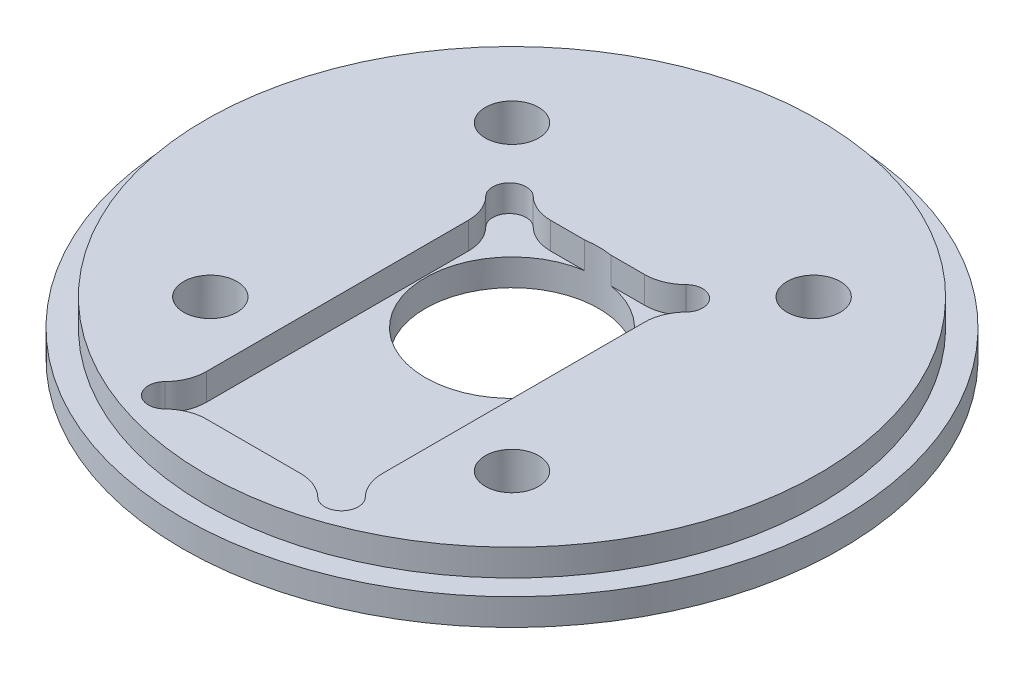
from build123d import *

# Parameters (mm, degrees)
SKETCH2_R                       = 39.243
BOSS_EXTRUDE1_DEPTH             = 6.35
CUT_EXTRUDE1_START              = -3.175
SKETCH4_R                       = 39.243
SKETCH4_R_2                     = 36.5125
CUT_EXTRUDE1_DEPTH              = 3.175
F_1_4_0_25_DIAMETER_HOLE1_D     = 6.35
F_13_16_0_8125_DIAMETER_HOLE1_D = 20.6375
CUT_EXTRUDE3_DEPTH              = 3.175
SKETCH9_R                       = 6.0325
CUT_EXTRUDE2_DEPTH              = 1.5875


with BuildPart() as part:
    # Sketch2 → Boss-Extrude1 (new body)
    with BuildSketch(Plane(origin=(0, 0, 0), x_dir=(1, 0, 0), z_dir=(0, 1, 0))):
        Circle(SKETCH2_R)
    extrude(amount=BOSS_EXTRUDE1_DEPTH)

    # Sketch4 → Cut-Extrude1 (cut)
    with BuildSketch(Plane(origin=(0, 6.35, 0), x_dir=(1, 0, 0), z_dir=(0, 1, 0)).offset(CUT_EXTRUDE1_START)):
        Circle(SKETCH4_R)
        Circle(SKETCH4_R_2, mode=Mode.SUBTRACT)
    extrude(amount=CUT_EXTRUDE1_DEPTH, mode=Mode.SUBTRACT)

    # 1/4 (0.25) Diameter Hole1 (through all)
    with Locations(Plane(origin=(0, 6.35, 0), x_dir=(1, 0, 0), z_dir=(0, 1, 0))):
        with Locations((-17.960512242, 17.960512242), (-17.960512242, -17.960512242), (17.960512242, 17.960512242), (17.960512242, -17.960512242)):
            Hole(F_1_4_0_25_DIAMETER_HOLE1_D / 2)

    # 13/16 (0.8125) Diameter Hole1 (through all)
    with Locations(Plane(origin=(0, 6.35, 0), x_dir=(1, 0, 0), z_dir=(0, 1, 0))):
        with Locations((0, 0)):
            Hole(F_13_16_0_8125_DIAMETER_HOLE1_D / 2)

    # Sketch11 → Cut-Extrude3 (cut)
    with BuildSketch(Plane(origin=(0, 6.35, 0), x_dir=(1, 0, 0), z_dir=(0, 1, 0))):
        with BuildLine():
            Line((-5.601020514, 10.2), (5.601020514, 10.2))
            ThreePointArc((5.601020514, 10.2), (7.490842879, 10.570899501), (9.100291576, 11.628571429))
            ThreePointArc((9.100291576, 11.628571429), (11.914213562, 11.614213562), (11.928571429, 8.800291576))
            ThreePointArc((11.928571429, 8.800291576), (10.870899501, 7.190842879), (10.5, 5.301020514))
            Line((10.5, 5.301020514), (10.5, -25.901020514))
            ThreePointArc((10.5, -25.901020514), (10.870899501, -27.790842879), (11.928571429, -29.400291576))
            ThreePointArc((11.928571429, -29.400291576), (11.914213562, -32.214213562), (9.100291576, -32.228571429))
            ThreePointArc((9.100291576, -32.228571429), (7.490842879, -31.170899501), (5.601020514, -30.8))
            Line((5.601020514, -30.8), (-5.601020514, -30.8))
            ThreePointArc((-5.601020514, -30.8), (-7.490842879, -31.170899501), (-9.100291576, -32.228571429))
            ThreePointArc((-9.100291576, -32.228571429), (-11.914213562, -32.214213562), (-11.928571429, -29.400291576))
            ThreePointArc((-11.928571429, -29.400291576), (-10.870899501, -27.790842879), (-10.5, -25.901020514))
            Line((-10.5, -25.901020514), (-10.5, 5.301020514))
            ThreePointArc((-10.5, 5.301020514), (-10.870899501, 7.190842879), (-11.928571429, 8.800291576))
            ThreePointArc((-11.928571429, 8.800291576), (-11.914213562, 11.614213562), (-9.100291576, 11.628571429))
            ThreePointArc((-9.100291576, 11.628571429), (-7.490842879, 10.570899501), (-5.601020514, 10.2))
        make_face()
    extrude(amount=-CUT_EXTRUDE3_DEPTH, mode=Mode.SUBTRACT)

    # Sketch9 → Cut-Extrude2 (cut)
    with BuildSketch(Plane.XZ):
        with Locations((-17.960512242, 17.960512242)):
            Circle(SKETCH9_R)
        with Locations((17.960512242, 17.960512242)):
            Circle(SKETCH9_R)
        with Locations((17.960512242, -17.960512242)):
            Circle(SKETCH9_R)
        with Locations((-17.960512242, -17.960512242)):
            Circle(SKETCH9_R)
    extrude(amount=-CUT_EXTRUDE2_DEPTH, mode=Mode.SUBTRACT)


solid = part.part
